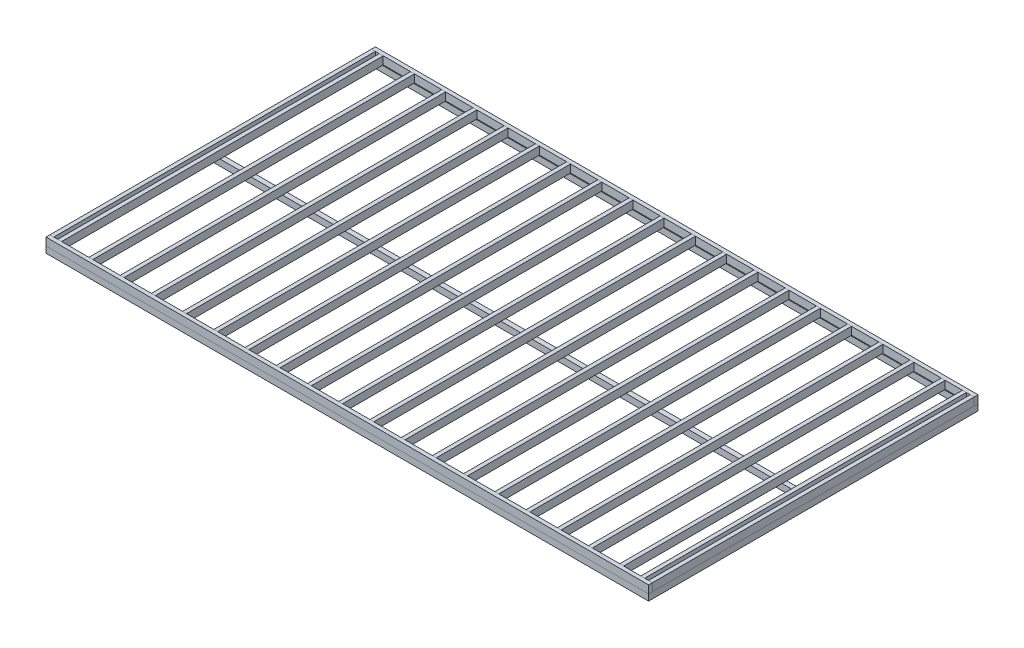
from build123d import *

# Parameters (mm, degrees)
METAL_FRAME_W         = 7720
METAL_FRAME_H         = 4220
METAL_FRAME_W_2       = 7600
METAL_FRAME_H_2       = 2020
METALFRAME_DEPTH      = 80
SKETCH4_W             = 7720
SKETCH4_H             = 50
BOSS_EXTRUDE2_DEPTH   = 100
BOSS_EXTRUDE2_2_DEPTH = 100
SKETCH4_3_W           = 50
SKETCH4_3_H           = 4120
BOSS_EXTRUDE3_DEPTH   = 100
BOSS_EXTRUDE3_2_DEPTH = 100
BOSS_EXTRUDE3_3_DEPTH = 100
BOSS_EXTRUDE3_4_DEPTH = 100
LPATTERN1_COUNT       = 19
LPATTERN1_PITCH       = 400


with BuildPart() as part:
    # Metal frame → MetalFrame (new body)
    with BuildSketch(Plane(origin=(0, 0, 0), x_dir=(1, 0, 0), z_dir=(0, 1, 0))):
        with Locations((3800, 2050)):
            Rectangle(METAL_FRAME_W, METAL_FRAME_H)
        with Locations((3800, 1010)):
            Rectangle(METAL_FRAME_W_2, METAL_FRAME_H_2, mode=Mode.SUBTRACT)
        with Locations((3800, 3090)):
            Rectangle(METAL_FRAME_W_2, METAL_FRAME_H_2, mode=Mode.SUBTRACT)
    extrude(amount=-METALFRAME_DEPTH)


with BuildPart() as body_2:
    # Sketch4 → Boss-Extrude2 (new body)
    with BuildSketch(Plane(origin=(0, 0, 0), x_dir=(1, 0, 0), z_dir=(0, 1, 0))):
        with Locations((3800, 4135)):
            Rectangle(SKETCH4_W, SKETCH4_H)
    extrude(amount=BOSS_EXTRUDE2_DEPTH)


with BuildPart() as body_3:
    # Sketch4 → Boss-Extrude2 2 (new body)
    with BuildSketch(Plane(origin=(0, 0, 0), x_dir=(1, 0, 0), z_dir=(0, 1, 0))):
        with Locations((3800, -35)):
            Rectangle(SKETCH4_W, SKETCH4_H)
    extrude(amount=BOSS_EXTRUDE2_2_DEPTH)


with BuildPart() as body_4:
    # Sketch4<3> → Boss-Extrude3 (new body)
    with BuildSketch(Plane(origin=(0, 0, 0), x_dir=(1, 0, 0), z_dir=(0, 1, 0))):
        with Locations((-35, 2050)):
            Rectangle(SKETCH4_3_W, SKETCH4_3_H)
    extrude(amount=BOSS_EXTRUDE3_DEPTH)


with BuildPart() as body_5:
    # Sketch4<3> → Boss-Extrude3 2 (new body)
    with BuildSketch(Plane(origin=(0, 0, 0), x_dir=(1, 0, 0), z_dir=(0, 1, 0))):
        with Locations((7635, 2050)):
            Rectangle(SKETCH4_3_W, SKETCH4_3_H)
    extrude(amount=BOSS_EXTRUDE3_2_DEPTH)


with BuildPart() as body_6:
    # Sketch4<3> → Boss-Extrude3 3 (new body)
    with BuildSketch(Plane(origin=(0, 0, 0), x_dir=(1, 0, 0), z_dir=(0, 1, 0))):
        with Locations((65, 2050)):
            Rectangle(SKETCH4_3_W, SKETCH4_3_H)
    extrude(amount=BOSS_EXTRUDE3_3_DEPTH)


with BuildPart() as body_7:
    # Sketch4<3> → Boss-Extrude3 4 (new body)
    with BuildSketch(Plane(origin=(0, 0, 0), x_dir=(1, 0, 0), z_dir=(0, 1, 0))):
        with Locations((7535, 2050)):
            Rectangle(SKETCH4_3_W, SKETCH4_3_H)
    extrude(amount=BOSS_EXTRUDE3_4_DEPTH)


with BuildPart() as lpattern1_1:
    # LPattern1: pattern copy
    add(body_6.part.moved(Location(Vector(1, 0, 0) * (1 * LPATTERN1_PITCH))))


with BuildPart() as lpattern1_2:
    # LPattern1: pattern copy
    add(body_6.part.moved(Location(Vector(1, 0, 0) * (2 * LPATTERN1_PITCH))))


with BuildPart() as lpattern1_3:
    # LPattern1: pattern copy
    add(body_6.part.moved(Location(Vector(1, 0, 0) * (3 * LPATTERN1_PITCH))))


with BuildPart() as lpattern1_4:
    # LPattern1: pattern copy
    add(body_6.part.moved(Location(Vector(1, 0, 0) * (4 * LPATTERN1_PITCH))))


with BuildPart() as lpattern1_5:
    # LPattern1: pattern copy
    add(body_6.part.moved(Location(Vector(1, 0, 0) * (5 * LPATTERN1_PITCH))))


with BuildPart() as lpattern1_6:
    # LPattern1: pattern copy
    add(body_6.part.moved(Location(Vector(1, 0, 0) * (6 * LPATTERN1_PITCH))))


with BuildPart() as lpattern1_7:
    # LPattern1: pattern copy
    add(body_6.part.moved(Location(Vector(1, 0, 0) * (7 * LPATTERN1_PITCH))))


with BuildPart() as lpattern1_8:
    # LPattern1: pattern copy
    add(body_6.part.moved(Location(Vector(1, 0, 0) * (8 * LPATTERN1_PITCH))))


with BuildPart() as lpattern1_9:
    # LPattern1: pattern copy
    add(body_6.part.moved(Location(Vector(1, 0, 0) * (9 * LPATTERN1_PITCH))))


with BuildPart() as lpattern1_10:
    # LPattern1: pattern copy
    add(body_6.part.moved(Location(Vector(1, 0, 0) * (10 * LPATTERN1_PITCH))))


with BuildPart() as lpattern1_11:
    # LPattern1: pattern copy
    add(body_6.part.moved(Location(Vector(1, 0, 0) * (11 * LPATTERN1_PITCH))))


with BuildPart() as lpattern1_12:
    # LPattern1: pattern copy
    add(body_6.part.moved(Location(Vector(1, 0, 0) * (12 * LPATTERN1_PITCH))))


with BuildPart() as lpattern1_13:
    # LPattern1: pattern copy
    add(body_6.part.moved(Location(Vector(1, 0, 0) * (13 * LPATTERN1_PITCH))))


with BuildPart() as lpattern1_14:
    # LPattern1: pattern copy
    add(body_6.part.moved(Location(Vector(1, 0, 0) * (14 * LPATTERN1_PITCH))))


with BuildPart() as lpattern1_15:
    # LPattern1: pattern copy
    add(body_6.part.moved(Location(Vector(1, 0, 0) * (15 * LPATTERN1_PITCH))))


with BuildPart() as lpattern1_16:
    # LPattern1: pattern copy
    add(body_6.part.moved(Location(Vector(1, 0, 0) * (16 * LPATTERN1_PITCH))))


with BuildPart() as lpattern1_17:
    # LPattern1: pattern copy
    add(body_6.part.moved(Location(Vector(1, 0, 0) * (17 * LPATTERN1_PITCH))))


with BuildPart() as lpattern1_18:
    # LPattern1: pattern copy
    add(body_6.part.moved(Location(Vector(1, 0, 0) * (18 * LPATTERN1_PITCH))))


solid = Compound([part.part, body_2.part, body_3.part, body_4.part, body_5.part, body_6.part, body_7.part, lpattern1_1.part, lpattern1_2.part, lpattern1_3.part, lpattern1_4.part, lpattern1_5.part, lpattern1_6.part, lpattern1_7.part, lpattern1_8.part, lpattern1_9.part, lpattern1_10.part, lpattern1_11.part, lpattern1_12.part, lpattern1_13.part, lpattern1_14.part, lpattern1_15.part, lpattern1_16.part, lpattern1_17.part, lpattern1_18.part])
